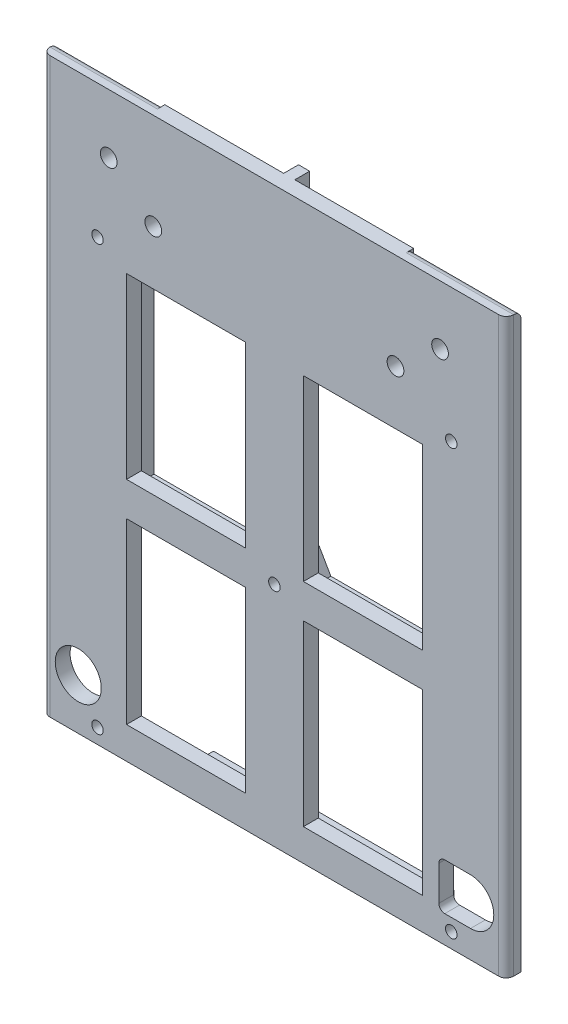
from build123d import *

# Parameters (mm, degrees)
SKETCH1_W                                         = 198.12
SKETCH1_H                                         = 255.039606789
BOSS_EXTRUDE1_DEPTH                               = 6.35
CSK_FOR_8_FLAT_HEAD_MACHINE_SCREW_100_D           = 4.9149
CSK_FOR_8_FLAT_HEAD_MACHINE_SCREW_100_CSINK_D     = 8.4328
CSK_FOR_8_FLAT_HEAD_MACHINE_SCREW_100_CSINK_ANGLE = 100
CUT_EXTRUDE1_REACH                                = 1922.068
SKETCH6_W                                         = 198.12
SKETCH6_H                                         = 10.174402562
F_1_4_CLEARANCE_HOLE1_D                           = 7.14248
FILLET1_R                                         = 3.175
SKETCH9_R                                         = 9.8425
SKETCH9_W                                         = 50.8
SKETCH9_H                                         = 76.2
CUT_EXTRUDE2_DEPTH                                = 1910.907696631
SKETCH10_W                                        = 15.875
SKETCH10_H                                        = 15.875
SKETCH10_H_2                                      = 25.4
BOSS_EXTRUDE2_DEPTH                               = 19.05
BOSS_EXTRUDE3_DEPTH                               = 6.35
DRAFT1_ANGLE                                      = 20
DRAFT2_START                                      = -80.01
DRAFT2_DEPTH                                      = 15.875
DRAFT2_START_2                                    = 64.135
DRAFT2_2_DEPTH                                    = 15.875
F_8_CLEARANCE_HOLE1_REACH                         = 1917.809
F_8_CLEARANCE_HOLE1_BORE_R                        = 2.45745
CUT_EXTRUDE3_START                                = -19.05
CUT_EXTRUDE3_DEPTH                                = 11.526916
CUT_EXTRUDE4_DEPTH                                = 1.651
CUT_EXTRUDE5_REACH                                = 262.327
SKETCH16_W                                        = 25.4
SKETCH16_H                                        = 6.35
CUT_EXTRUDE6_REACH                                = 1911.992
SKETCH17_W                                        = 15.875
SKETCH17_H                                        = 43.91025
FILLET2_START                                     = -100
FILLET2_DEPTH                                     = 46.81875
FILLET2_START_2                                   = 53.18125
FILLET2_2_DEPTH                                   = 46.81875


with BuildPart() as part:
    # Sketch1 → Boss-Extrude1 (new body)
    with BuildSketch(Plane.XY):
        with Locations((0, -1789.981053539)):
            Rectangle(SKETCH1_W, SKETCH1_H)
    extrude(amount=BOSS_EXTRUDE1_DEPTH)

    # CSK for #8 Flat Head Machine Screw (100)2 (through all)
    with Locations(Plane(origin=(0, 0, 0), x_dir=(-1, 0, 0), z_dir=(0, 0, -1))):
        with Locations((75.59625, -1900.97645438), (-75.59625, -1900.97645438), (75.59625, -1719.49345438), (-75.59625, -1719.49345438), (0, -1810.23495438)):
            CounterSinkHole(CSK_FOR_8_FLAT_HEAD_MACHINE_SCREW_100_D / 2, CSK_FOR_8_FLAT_HEAD_MACHINE_SCREW_100_CSINK_D / 2, counter_sink_angle=CSK_FOR_8_FLAT_HEAD_MACHINE_SCREW_100_CSINK_ANGLE)

    # Sketch6 → Cut-Extrude1 (cut, up to next)
    with BuildSketch(Plane.XY.offset(6.35), mode=Mode.PRIVATE) as cut_extrude1_sk1:
        with Locations((0, -1912.413655653)):
            Rectangle(SKETCH6_W, SKETCH6_H)
    cut_extrude1_tool1 = extrude(cut_extrude1_sk1.sketch, amount=-CUT_EXTRUDE1_REACH, mode=Mode.PRIVATE) & part.part
    add(cut_extrude1_tool1.solids().sort_by_distance((0, -1912.413656, 6.35))[0], mode=Mode.SUBTRACT)

    # 1/4 Clearance Hole1 (through all)
    with Locations(Plane.XY.offset(6.35)):
        with Locations((70.8025, -1687.74345438), (-70.8025, -1687.74345438), (-51.7525, -1703.61845438), (51.7525, -1703.61845438)):
            Hole(F_1_4_CLEARANCE_HOLE1_D / 2)

    # Fillet1
    fillet1_edges = [part.edges().sort_by_distance(p)[0] for p in [
        (-99.06, -1784.893852259, 6.35),
        (99.06, -1784.893852259, 6.35),
    ]]
    fillet(fillet1_edges, radius=FILLET1_R)

    # Sketch9 → Cut-Extrude2 (cut, through all)
    with BuildSketch(Plane(origin=(0, 0, 0), x_dir=(-1, 0, 0), z_dir=(0, 0, -1))):
        with Locations((83.82, -1885.73645438)):
            Circle(SKETCH9_R)
        with Locations((-37.798125, -1855.60570438)):
            Rectangle(SKETCH9_W, SKETCH9_H)
        with Locations((37.798125, -1855.60570438)):
            Rectangle(SKETCH9_W, SKETCH9_H)
        with Locations((37.798125, -1764.86420438)):
            Rectangle(SKETCH9_W, SKETCH9_H)
        with Locations((-37.798125, -1764.86420438)):
            Rectangle(SKETCH9_W, SKETCH9_H)
        with BuildLine():
            Line((-83.82, -1875.789551383), (-72.8191921, -1875.789551383))
            ThreePointArc((-72.8191921, -1875.789551383), (-71.023140876, -1876.533500159), (-70.2791921, -1878.329551383))
            Line((-70.2791921, -1878.329551383), (-70.2791921, -1893.143357377))
            ThreePointArc((-70.2791921, -1893.143357377), (-71.023140876, -1894.939408601), (-72.8191921, -1895.683357377))
            Line((-72.8191921, -1895.683357377), (-83.82, -1895.683357377))
            ThreePointArc((-83.82, -1895.683357377), (-93.766902997, -1885.73645438), (-83.82, -1875.789551383))
        make_face()
    extrude(amount=-CUT_EXTRUDE2_DEPTH, mode=Mode.SUBTRACT)

    # Sketch10 → Boss-Extrude2 (add)
    with BuildSketch(Plane(origin=(0, 0, 0), x_dir=(-1, 0, 0), z_dir=(0, 0, -1))):
        with Locations((-72.0725, -1705.323750137)):
            Rectangle(SKETCH10_W, SKETCH10_H)
        with Locations((72.0725, -1843.82645438)):
            Rectangle(SKETCH10_W, SKETCH10_H_2)
        with Locations((72.0725, -1705.323750137)):
            Rectangle(SKETCH10_W, SKETCH10_H)
        with Locations((-72.0725, -1843.82645438)):
            Rectangle(SKETCH10_W, SKETCH10_H_2)
    extrude(amount=BOSS_EXTRUDE2_DEPTH)

    # Sketch11 → Boss-Extrude3 (add)
    with BuildSketch(Plane(origin=(0, 0, 0), x_dir=(-1, 0, 0), z_dir=(0, 0, -1))):
        Polygon((-64.135, -1718.020391975), (-64.135, -1713.261250137), (-68.8975, -1713.261250137), (-68.8975, -1831.12645438), (-64.135, -1831.12645438), (-64.135, -1812.61620438), (-11.456794404, -1812.61620438), (-6.415804866, -1821.34745438), (-2.38125, -1821.34745438), (-2.38125, -1897.67445438), (-64.135, -1897.67445438), (-64.135, -1902.449516786), (-2.38125, -1902.449516786), (-2.38125, -1907.32645438), (2.38125, -1907.32645438), (2.38125, -1902.449516786), (64.135, -1902.449516786), (64.135, -1897.67445438), (2.38125, -1897.67445438), (2.38125, -1821.34745438), (6.415804866, -1821.34745438), (11.456794404, -1812.61620438), (64.135, -1812.61620438), (64.135, -1831.12645438), (68.8975, -1831.12645438), (68.8975, -1713.261250137), (64.135, -1713.261250137), (64.135, -1718.020391975), (2.38125, -1718.020391975), (2.38125, -1662.461250145), (-2.38125, -1662.461250145), (-2.38125, -1718.020391975), align=None)
        Polygon((-5.95753309, -1812.61620438), (-7.332348419, -1810.23495438), (-5.95753309, -1807.85370438), (-3.666174209, -1803.88495438), (3.666174209, -1803.88495438), (7.332348419, -1810.23495438), (3.666174209, -1816.58495438), (-3.666174209, -1816.58495438), align=None, mode=Mode.SUBTRACT)
        Polygon((-64.135, -1807.85370438), (-64.135, -1722.79545438), (-2.38125, -1722.79545438), (-2.38125, -1799.12245438), (-6.415804866, -1799.12245438), (-11.456794404, -1807.85370438), align=None, mode=Mode.SUBTRACT)
        Polygon((64.135, -1807.85370438), (11.456794404, -1807.85370438), (6.415804866, -1799.12245438), (2.38125, -1799.12245438), (2.38125, -1722.79545438), (64.135, -1722.79545438), align=None, mode=Mode.SUBTRACT)
    extrude(amount=BOSS_EXTRUDE3_DEPTH)

    # Draft1
    draft1_faces = [part.faces().sort_by_distance(p)[0] for p in [
        (72.689861111, -1831.12645438, -10.230555556),
        (-72.689861111, -1831.12645438, -10.230555556),
    ]]
    draft(draft1_faces, Plane(origin=(0, 0, -19.05), x_dir=(-1, 0, 0), z_dir=(0, 0, -1)), DRAFT1_ANGLE)

    # Draft2: read off the stored shape, not the designer's step
    # Draft2 outline → Draft2 (add)
    with BuildSketch(Plane.YZ.offset(DRAFT2_START)):
        Polygon((-1718.365682253, 0), (-1713.261250137, -19.05), (-1713.261250137, 0), align=None)
    extrude(amount=DRAFT2_DEPTH)

    # Draft2 2 outline → Draft2 2 (add)
    with BuildSketch(Plane.YZ.offset(DRAFT2_START_2)):
        Polygon((-1718.365682253, 0), (-1713.261250137, -19.05), (-1713.261250137, 0), align=None)
    extrude(amount=DRAFT2_2_DEPTH)

    # #8 Clearance Hole1 bore → #8 Clearance Hole1 (cut, up to next)
    with BuildSketch(Plane(origin=(80.01, 0, 0), x_dir=(0, 0, -1), z_dir=(1, 0, 0)), mode=Mode.PRIVATE) as f_8_clearance_hole1_sk1:
        with Locations((14.2875, -1843.82645438)):
            Circle(F_8_CLEARANCE_HOLE1_BORE_R)
    f_8_clearance_hole1_tool1 = extrude(f_8_clearance_hole1_sk1.sketch, amount=-F_8_CLEARANCE_HOLE1_REACH, mode=Mode.PRIVATE) & part.part
    # #8 Clearance Hole1 bore → #8 Clearance Hole1 (cut, up to next)
    with BuildSketch(Plane(origin=(80.01, 0, 0), x_dir=(0, 0, -1), z_dir=(1, 0, 0)), mode=Mode.PRIVATE) as f_8_clearance_hole1_sk2:
        with Locations((14.2875, -1705.323750137)):
            Circle(F_8_CLEARANCE_HOLE1_BORE_R)
    f_8_clearance_hole1_tool2 = extrude(f_8_clearance_hole1_sk2.sketch, amount=-F_8_CLEARANCE_HOLE1_REACH, mode=Mode.PRIVATE) & part.part
    f_8_clearance_hole1_1 = f_8_clearance_hole1_tool1.solids().sort_by_distance((80.01, -1843.826454, -14.2875))[0]
    add(f_8_clearance_hole1_1, mode=Mode.SUBTRACT)
    f_8_clearance_hole1_2 = f_8_clearance_hole1_tool2.solids().sort_by_distance((80.01, -1705.32375, -14.2875))[0]
    add(f_8_clearance_hole1_2, mode=Mode.SUBTRACT)
    f_8_clearance_hole1 = f_8_clearance_hole1_1 + f_8_clearance_hole1_2  # #8 Clearance Hole1 as one shape, for the pattern or mirror that repeats it

    # Sketch14 → Cut-Extrude3 (cut)
    with BuildSketch(Plane(origin=(0, 0, -19.05), x_dir=(-1, 0, 0), z_dir=(0, 0, -1)).offset(CUT_EXTRUDE3_START)):
        with BuildLine():
            Line((75.59625, -1715.27705438), (80.01, -1715.27705438))
            Line((80.01, -1715.27705438), (80.01, -1723.70985438))
            Line((80.01, -1723.70985438), (75.59625, -1723.70985438))
            ThreePointArc((75.59625, -1723.70985438), (71.37985, -1719.49345438), (75.59625, -1715.27705438))
        make_face()
        with BuildLine():
            Line((-80.01, -1723.70985438), (-75.59625, -1723.70985438))
            ThreePointArc((-75.59625, -1723.70985438), (-71.37985, -1719.49345438), (-75.59625, -1715.27705438))
            Line((-75.59625, -1715.27705438), (-80.01, -1715.27705438))
            Line((-80.01, -1715.27705438), (-80.01, -1723.70985438))
        make_face()
    extrude(amount=CUT_EXTRUDE3_DEPTH, mode=Mode.SUBTRACT)

    # Sketch15 → Cut-Extrude4 (cut, symmetric)
    with BuildSketch(Plane.ZY.offset(-72.0725)):
        Polygon((-9.7917, -1707.919401478), (-9.7917, -1702.728098797), (-14.2875, -1700.132447457), (-19.05, -1700.132447457), (-19.05, -1710.515052818), (-14.2875, -1710.515052818), align=None)
        Polygon((-19.05, -1838.6351517), (-14.2875, -1838.6351517), (-9.7917, -1841.23080304), (-9.7917, -1846.42210572), (-14.2875, -1849.01775706), (-19.05, -1849.01775706), align=None)
    cut_extrude4 = extrude(amount=CUT_EXTRUDE4_DEPTH, both=True, mode=Mode.SUBTRACT)

    # Mirror1: #8 Clearance Hole1, Cut-Extrude4 across plane
    add(f_8_clearance_hole1.mirror(Plane(origin=(0, 0, 0), x_dir=(0, 0, 1), z_dir=(1, 0, 0))), mode=Mode.SUBTRACT)
    add(cut_extrude4.mirror(Plane(origin=(0, 0, 0), x_dir=(0, 0, 1), z_dir=(1, 0, 0))), mode=Mode.SUBTRACT)

    # Sketch16 → Cut-Extrude5 (cut, up to next)
    with BuildSketch(Plane.XZ.offset(1902.449516786), mode=Mode.PRIVATE) as cut_extrude5_sk1:
        with Locations((-51.435, -3.175)):
            Rectangle(SKETCH16_W, SKETCH16_H)
    cut_extrude5_tool1 = extrude(cut_extrude5_sk1.sketch, amount=-CUT_EXTRUDE5_REACH, mode=Mode.PRIVATE) & part.part
    add(cut_extrude5_tool1.solids().sort_by_distance((-51.435, -1902.449517, -3.175))[0], mode=Mode.SUBTRACT)

    # Sketch17 → Cut-Extrude6 (cut, up to next)
    with BuildSketch(Plane(origin=(0, 0, 0), x_dir=(-1, 0, 0), z_dir=(0, 0, -1)), mode=Mode.PRIVATE) as cut_extrude6_sk1:
        with Locations((72.0725, -1834.57132938)):
            Rectangle(SKETCH17_W, SKETCH17_H)
    cut_extrude6_tool1 = extrude(cut_extrude6_sk1.sketch, amount=CUT_EXTRUDE6_REACH, mode=Mode.PRIVATE) & part.part
    add(cut_extrude6_tool1.solids().sort_by_distance((-72.0725, -1834.571329, 0))[0], mode=Mode.SUBTRACT)

    # Fillet2: read off the stored shape, not the designer's step
    # Fillet2 outline → Fillet2 (cut)
    with BuildSketch(Plane.YZ.offset(FILLET2_START)):
        with BuildLine():
            ThreePointArc((-1662.461250145, 3.175), (-1663.391186115, 0.92993597), (-1665.636250145, 0))
            Line((-1665.636250145, 0), (-1662.461250145, 0))
            Line((-1662.461250145, 0), (-1662.461250145, 3.175))
        make_face()
    extrude(amount=FILLET2_DEPTH, mode=Mode.SUBTRACT)

    # Fillet2 2 outline → Fillet2 2 (cut)
    with BuildSketch(Plane.YZ.offset(FILLET2_START_2)):
        with BuildLine():
            ThreePointArc((-1662.461250145, 3.175), (-1663.391186115, 0.92993597), (-1665.636250145, 0))
            Line((-1665.636250145, 0), (-1662.461250145, 0))
            Line((-1662.461250145, 0), (-1662.461250145, 3.175))
        make_face()
    extrude(amount=FILLET2_2_DEPTH, mode=Mode.SUBTRACT)


solid = part.part
